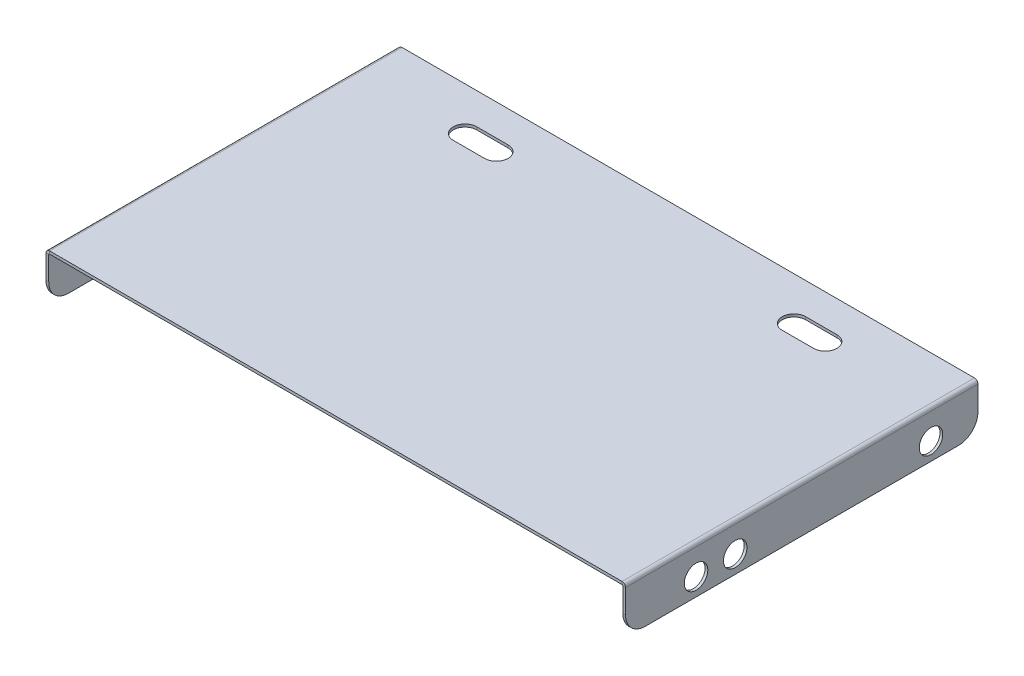
from build123d import *

# Parameters (mm, degrees)
SKETCH_1_W                         = 148
SKETCH_1_H                         = 90
SM_BASE_FLANGE_1_DEPTH             = 0.7
SM_EDGE_FLANGE_1_STRIP_W           = 3.2
SM_EDGE_FLANGE_1_STRIP_H           = 0.7
SM_EDGE_FLANGE_1_STRIP_CUT_DEPTH   = 90
SM_EDGE_FLANGE_1_STRIP_2_W         = 3.2
SM_EDGE_FLANGE_1_STRIP_2_H         = 0.7
SM_EDGE_FLANGE_1_STRIP_CUT_2_DEPTH = 90
SM_EDGE_FLANGE_1_DEPTH             = 90
SM_EDGE_FLANGE_1_PROFILE_W         = 90
SM_EDGE_FLANGE_1_PROFILE_H         = 11.1
SM_EDGE_FLANGE_1_PROFILE_R         = 3
SM_EDGE_FLANGE_1_FLAT_DEPTH        = 0.7
SM_EDGE_FLANGE_1_BEND_DEPTH        = 90
FILLET_2_R                         = 5
CUT_EXTRUDE_START                  = -10
SKETCH_15_R                        = 3
CUT_EXTRUDE_1_DEPTH                = 10


# Sheet-metal steps are written as plain solids
with BuildPart() as part:
    # Sketch 1 → 基体-法兰1 (new body)
    with BuildSketch(Plane(origin=(0, 0, 0), x_dir=(1, 0, 0), z_dir=(0, 1, 0))):
        Rectangle(SKETCH_1_W, SKETCH_1_H)
        with BuildLine():
            Line((-46, 37), (-38, 37))
            ThreePointArc((-38, 37), (-35, 34), (-38, 31))
            Line((-38, 31), (-46, 31))
            ThreePointArc((-46, 31), (-49, 34), (-46, 37))
        make_face(mode=Mode.SUBTRACT)
        with BuildLine():
            Line((38, 37), (46, 37))
            ThreePointArc((46, 37), (49, 34), (46, 31))
            Line((46, 31), (38, 31))
            ThreePointArc((38, 31), (35, 34), (38, 37))
        make_face(mode=Mode.SUBTRACT)
    extrude(amount=-SM_BASE_FLANGE_1_DEPTH)

    # 边线-法兰1 strip (across the edge) → 边线-法兰1 strip cut (cut)
    with BuildSketch(Plane(origin=(74, -0.7, -45), x_dir=(-1, 0, 0), z_dir=(0, 0, 1))):
        with Locations((-0.7, -0.35)):
            Rectangle(SM_EDGE_FLANGE_1_STRIP_W, SM_EDGE_FLANGE_1_STRIP_H)
    extrude(amount=SM_EDGE_FLANGE_1_STRIP_CUT_DEPTH, mode=Mode.SUBTRACT)

    # 边线-法兰1 strip 2 (across the edge) → 边线-法兰1 strip cut 2 (cut)
    with BuildSketch(Plane(origin=(-74, -0.7, 45), x_dir=(1, 0, 0), z_dir=(0, 0, -1))):
        with Locations((-0.7, -0.35)):
            Rectangle(SM_EDGE_FLANGE_1_STRIP_2_W, SM_EDGE_FLANGE_1_STRIP_2_H)
    extrude(amount=SM_EDGE_FLANGE_1_STRIP_CUT_2_DEPTH, mode=Mode.SUBTRACT)

    # 边线-法兰1 bend section (across the edge) → 边线-法兰1 (add)
    with BuildSketch(Plane(origin=(74, -0.7, -45), x_dir=(-1, 0, 0), z_dir=(0, 0, 1))):
        with BuildLine():
            Line((0, 0.2), (0.7, 0.2))
            ThreePointArc((0.7, 0.2), (0.758578644, 0.058578644), (0.9, 0))
            Line((0.9, 0), (0.9, -0.7))
            ThreePointArc((0.9, -0.7), (0.263603897, -0.436396103), (0, 0.2))
        make_face()
    extrude(amount=SM_EDGE_FLANGE_1_DEPTH)

    # 边线-法兰1 profile (on flange) → 边线-法兰1 flat (add)
    with BuildSketch(Plane(origin=(74, -0.7, 0), x_dir=(0, 0, 1), z_dir=(1, 0, 0))):
        with Locations((0, 5.75)):
            Rectangle(SM_EDGE_FLANGE_1_PROFILE_W, SM_EDGE_FLANGE_1_PROFILE_H)
        with Locations((17, 6.8)):
            Circle(SM_EDGE_FLANGE_1_PROFILE_R, mode=Mode.SUBTRACT)
        with Locations((27, 6.8)):
            Circle(SM_EDGE_FLANGE_1_PROFILE_R, mode=Mode.SUBTRACT)
        with Locations((-33, 6.8)):
            Circle(SM_EDGE_FLANGE_1_PROFILE_R, mode=Mode.SUBTRACT)
    extrude(amount=-SM_EDGE_FLANGE_1_FLAT_DEPTH)

    # 边线-法兰1 section (across the edge) → 边线-法兰1 bend (add)
    with BuildSketch(Plane(origin=(-74, -0.7, 45), x_dir=(1, 0, 0), z_dir=(0, 0, -1))):
        with BuildLine():
            Line((0, 0.2), (0, 11.3))
            Line((0, 11.3), (0.7, 11.3))
            Line((0.7, 11.3), (0.7, 0.2))
            ThreePointArc((0.7, 0.2), (0.758578644, 0.058578644), (0.9, 0))
            Line((0.9, 0), (0.9, -0.7))
            ThreePointArc((0.9, -0.7), (0.263603897, -0.436396103), (0, 0.2))
        make_face()
    extrude(amount=SM_EDGE_FLANGE_1_BEND_DEPTH)

    # 圆角2
    fillet_2_edges = [part.edges().sort_by_distance(p)[0] for p in [
        (-73.65, -12, 45),
        (-73.65, -12, -45),
        (73.65, -12, -45),
        (73.65, -12, 45),
    ]]
    fillet(fillet_2_edges, radius=FILLET_2_R)

    # 草图15 → 切除-拉伸1 (cut)
    with BuildSketch(Plane.ZY.offset(74).offset(CUT_EXTRUDE_START)):
        with Locations(Location((-33, -7.5, 0), (0, 0, 270))):
            Circle(SKETCH_15_R)
        with Locations(Location((17, -7.5, 0), (0, 0, 270))):
            Circle(SKETCH_15_R)
        with Locations(Location((27, -7.5, 0), (0, 0, 270))):
            Circle(SKETCH_15_R)
    extrude(amount=CUT_EXTRUDE_1_DEPTH, mode=Mode.SUBTRACT)


solid = part.part
